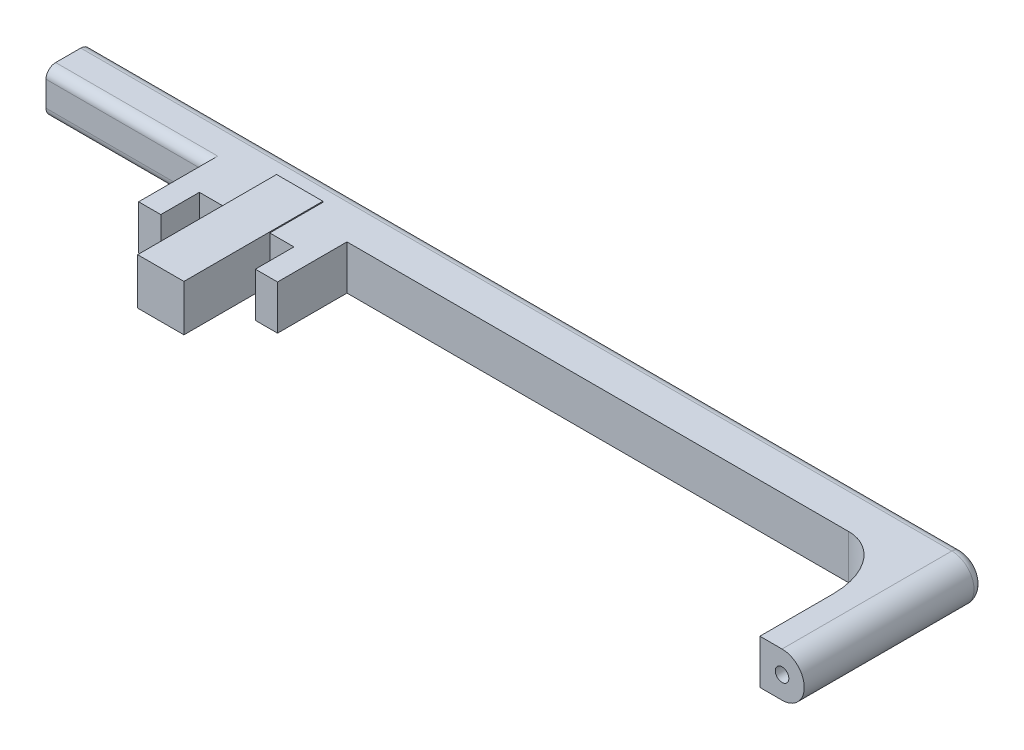
from build123d import *

# Parameters (mm, degrees)
SKETCH_1_W           = 2.4
SKETCH_1_H           = 2.4
EXTRUDE_1_DEPTH      = 7.2
EXTRUDE_2_DEPTH      = 32
EXTRUDE_2_DEPTH_BACK = 12
SKETCH_4_W           = 2.3
SKETCH_4_H           = 2.3
EXTRUDE_3_DEPTH      = 7
EXTRUDE_3_DEPTH_BACK = 2.3
SKETCH_5_R           = 0.35
SKETCH_6_R           = 0.35
CUT_EXTRUDE_1_DEPTH  = 10
FILLET_1_SIZE        = 2.4
FILLET_1_SIZE_2      = 3.2
FILLET_2_R           = 0.5
EXTRUDE_START        = -1.5
SKETCH_7_W           = 1.15
SKETCH_7_H           = 0.5
SKETCH_7_H_2         = 1.3
SKETCH_7_H_3         = 2.3
EXTRUDE_4_DEPTH      = 5.1
SKETCH_8_W           = 7.2
SKETCH_8_H           = 2.3
EXTRUDE_5_DEPTH      = 3.1


with BuildPart() as part:
    # 草图1 → 凸台-拉伸1 (new body)
    with BuildSketch(Plane.XY):
        Rectangle(SKETCH_1_W, SKETCH_1_H)
    extrude(amount=EXTRUDE_1_DEPTH)

    # 草图4 → 凸台-拉伸2 (add, two sides: drawn at the far end of the back side and taken through both)
    with BuildSketch(Plane(origin=(0, 0, 0), x_dir=(0, 0, -1), z_dir=(1, 0, 0)).offset(-EXTRUDE_2_DEPTH_BACK)):
        Rectangle(SKETCH_4_W, SKETCH_4_H)
    extrude(amount=EXTRUDE_2_DEPTH + EXTRUDE_2_DEPTH_BACK)

    # 草图5 → 凸台-拉伸3 (add, two sides: drawn at the far end of the back side and taken through both)
    with BuildSketch(Plane.XY.offset(1.15).offset(-EXTRUDE_3_DEPTH_BACK)):
        with BuildLine():
            Line((32, 0), (32, 1.15))
            Line((32, 1.15), (33.15, 1.15))
            ThreePointArc((33.15, 1.15), (34.3, 0), (33.15, -1.15))
            Line((33.15, -1.15), (32, -1.15))
            Line((32, -1.15), (32, 0))
        make_face()
        with Locations(Location((33.15, 0, 0), (0, 0, 180))):
            Circle(SKETCH_5_R, mode=Mode.SUBTRACT)
    extrude(amount=EXTRUDE_3_DEPTH + EXTRUDE_3_DEPTH_BACK)

    # 草图6 → 切除-拉伸1 (cut)
    with BuildSketch(Plane.ZY.offset(12)):
        Circle(SKETCH_6_R)
    extrude(amount=-CUT_EXTRUDE_1_DEPTH, mode=Mode.SUBTRACT)

    # 圆角1
    # an asymmetric fillet: 3.2, 2.4 mm, written as the material it adds along each edge
    with BuildSketch(Plane(origin=(32, 1.15, 1.15), x_dir=(-1, 0, 0), z_dir=(0, -1, 0))) as fillet_1_piece_1:
        with BuildLine():
            Bezier((FILLET_1_SIZE, 0), (0, 0), (0, -FILLET_1_SIZE_2), weights=[1, 0.707106781, 1])
            Line((0, -FILLET_1_SIZE_2), (0, 0))
            Line((0, 0), (FILLET_1_SIZE, 0))
        make_face()
    extrude(amount=2.3)

    # 圆角2
    fillet_2_edges = [part.edges().sort_by_distance(p)[0] for p in [
        (-6.6, -1.15, 1.15),
        (10.575, -1.15, -1.15),
        (-6.6, 1.15, 1.15),
        (10.575, 1.15, -1.15),
        (34.3, 0, -1.15),
    ]]
    fillet(fillet_2_edges, radius=FILLET_2_R)

    # 草图7 → 凸台-拉伸4 (add)
    with BuildSketch(Plane.XY.offset(1.15).offset(EXTRUDE_START)):
        with Locations((-3.025, 0.9)):
            Rectangle(SKETCH_7_W, SKETCH_7_H)
        with Locations((-3.025, 0)):
            Rectangle(SKETCH_7_W, SKETCH_7_H_2)
        with Locations((-3.025, -0.9)):
            Rectangle(SKETCH_7_W, SKETCH_7_H)
        with Locations((3.025, 0)):
            Rectangle(SKETCH_7_W, SKETCH_7_H_3)
    extrude(amount=EXTRUDE_4_DEPTH)

    # 草图8 → 凸台-拉伸5 (add)
    with BuildSketch(Plane.XY.offset(1.15).offset(EXTRUDE_START)):
        Rectangle(SKETCH_8_W, SKETCH_8_H)
    extrude(amount=EXTRUDE_5_DEPTH)


solid = part.part
